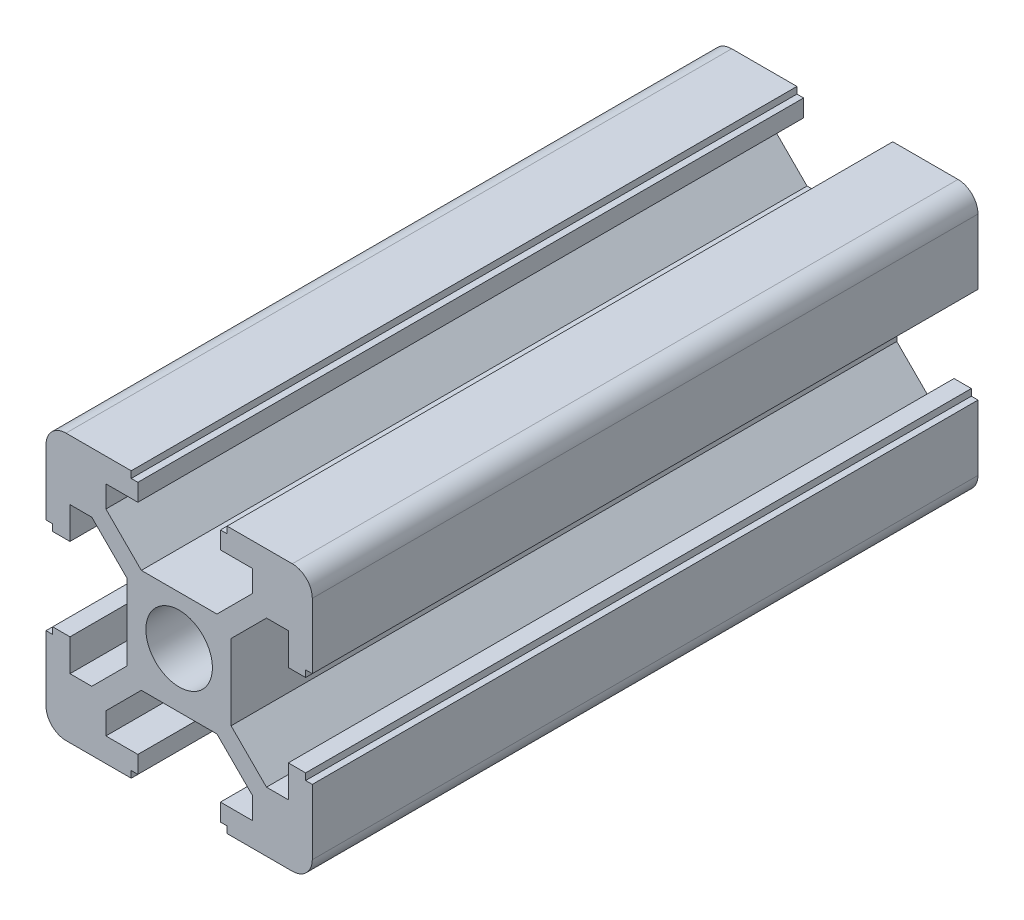
from build123d import *

# Parameters (mm, degrees)
SKETCH1_R           = 2.5
BOSS_EXTRUDE1_DEPTH = 50
SCALE_2_SCALE       = 3
SCALE_3_SCALE       = 6
SCALE_5_SCALE       = 2
SCALE_6_SCALE       = 0.25
SCALE_7_SCALE       = 0.125
SCALE_8_SCALE       = 0.25
SCALE_9_SCALE       = 4
SCALE_10_SCALE      = 4
OTHER_START         = -17.55
OTHER_1_OUTLINE_R   = 5
OTHER_1_DEPTH       = 10
SCALE_11_SCALE      = 0.111111111


# Read off the part's stored shape, not the designer's step: 孔1
with BuildPart() as part:
    # Sketch1 → Boss-Extrude1 (new body)
    with BuildSketch(Plane.XY):
        with BuildLine():
            Line((2.839339828, 3.9), (5.5, 6.560660172))
            Line((5.5, 6.560660172), (5.5, 8.2))
            Line((5.5, 8.2), (3.1, 8.2))
            Line((3.1, 8.2), (3.1, 9.5))
            Line((3.1, 9.5), (3.6, 9.5))
            Line((3.6, 9.5), (3.6, 10))
            Line((3.6, 10), (8.5, 10))
            ThreePointArc((8.5, 10), (9.560660172, 9.560660172), (10, 8.5))
            Line((10, 8.5), (10, 3.6))
            Line((10, 3.6), (9.5, 3.6))
            Line((9.5, 3.6), (9.5, 3.1))
            Line((9.5, 3.1), (8.2, 3.1))
            Line((8.2, 3.1), (8.2, 5.5))
            Line((8.2, 5.5), (6.560660172, 5.5))
            Line((6.560660172, 5.5), (3.9, 2.839339828))
            Line((3.9, 2.839339828), (3.9, -2.839339828))
            Line((3.9, -2.839339828), (6.560660172, -5.5))
            Line((6.560660172, -5.5), (8.2, -5.5))
            Line((8.2, -5.5), (8.2, -3.1))
            Line((8.2, -3.1), (9.5, -3.1))
            Line((9.5, -3.1), (9.5, -3.6))
            Line((9.5, -3.6), (10, -3.6))
            Line((10, -3.6), (10, -8.5))
            ThreePointArc((10, -8.5), (9.560660172, -9.560660172), (8.5, -10))
            Line((8.5, -10), (3.6, -10))
            Line((3.6, -10), (3.6, -9.5))
            Line((3.6, -9.5), (3.1, -9.5))
            Line((3.1, -9.5), (3.1, -8.2))
            Line((3.1, -8.2), (5.5, -8.2))
            Line((5.5, -8.2), (5.5, -6.560660172))
            Line((5.5, -6.560660172), (2.839339828, -3.9))
            Line((2.839339828, -3.9), (-2.839339828, -3.9))
            Line((-2.839339828, -3.9), (-5.5, -6.560660172))
            Line((-5.5, -6.560660172), (-5.5, -8.2))
            Line((-5.5, -8.2), (-3.1, -8.2))
            Line((-3.1, -8.2), (-3.1, -9.5))
            Line((-3.1, -9.5), (-3.6, -9.5))
            Line((-3.6, -9.5), (-3.6, -10))
            Line((-3.6, -10), (-8.5, -10))
            ThreePointArc((-8.5, -10), (-9.560660172, -9.560660172), (-10, -8.5))
            Line((-10, -8.5), (-10, -3.6))
            Line((-10, -3.6), (-9.5, -3.6))
            Line((-9.5, -3.6), (-9.5, -3.1))
            Line((-9.5, -3.1), (-8.2, -3.1))
            Line((-8.2, -3.1), (-8.2, -5.5))
            Line((-8.2, -5.5), (-6.560660172, -5.5))
            Line((-6.560660172, -5.5), (-3.9, -2.839339828))
            Line((-3.9, -2.839339828), (-3.9, 2.839339828))
            Line((-3.9, 2.839339828), (-6.560660172, 5.5))
            Line((-6.560660172, 5.5), (-8.2, 5.5))
            Line((-8.2, 5.5), (-8.2, 3.1))
            Line((-8.2, 3.1), (-9.5, 3.1))
            Line((-9.5, 3.1), (-9.5, 3.6))
            Line((-9.5, 3.6), (-10, 3.6))
            Line((-10, 3.6), (-10, 8.5))
            ThreePointArc((-10, 8.5), (-9.560660172, 9.560660172), (-8.5, 10))
            Line((-8.5, 10), (-3.6, 10))
            Line((-3.6, 10), (-3.6, 9.5))
            Line((-3.6, 9.5), (-3.1, 9.5))
            Line((-3.1, 9.5), (-3.1, 8.2))
            Line((-3.1, 8.2), (-5.5, 8.2))
            Line((-5.5, 8.2), (-5.5, 6.560660172))
            Line((-5.5, 6.560660172), (-2.839339828, 3.9))
            Line((-2.839339828, 3.9), (2.839339828, 3.9))
        make_face()
        with Locations((0, 0.235847297)):
            Circle(SKETCH1_R, mode=Mode.SUBTRACT)
    extrude(amount=BOSS_EXTRUDE1_DEPTH)


with BuildPart() as part_1:
    # 缩放比例2: scaled about (0, -0.027095247, 25)
    add(part.part.scale(SCALE_2_SCALE).moved(Location((0, 0.054190494, -50))))


with BuildPart() as part_2:
    # 缩放比例3: scaled about (0, -0.027095247, 25)
    add(part_1.part.scale(SCALE_3_SCALE).moved(Location((0, 0.135476235, -125))))


with BuildPart() as part_3:
    # 缩放比例5: scaled about (0, -0.027095249, 25)
    add(part_2.part.scale(SCALE_5_SCALE).moved(Location((0, 0.027095249, -25))))


with BuildPart() as part_4:
    # 缩放比例6: scaled about (0, -0.027095249, 25)
    add(part_3.part.scale(SCALE_6_SCALE).moved(Location((0, -0.020321437, 18.75))))


with BuildPart() as part_5:
    # 缩放比例7: scaled about (0, -0.027095249, 25)
    add(part_4.part.scale(SCALE_7_SCALE).moved(Location((0, -0.023708343, 21.875))))


with BuildPart() as part_6:
    # 缩放比例8: scaled about (0, -0.027095249, 25)
    add(part_5.part.scale(SCALE_8_SCALE).moved(Location((0, -0.020321437, 18.75))))


with BuildPart() as part_7:
    # 缩放比例9: scaled about (0, -0.027095249, 25)
    add(part_6.part.scale(SCALE_9_SCALE).moved(Location((0, 0.081285747, -75))))


with BuildPart() as part_8:
    # 缩放比例10: scaled about (0, -0.027095249, 25)
    add(part_7.part.scale(SCALE_10_SCALE).moved(Location((0, 0.081285747, -75))))

    # 孔1 outline → 孔1 (cut)
    with BuildSketch(Plane.YZ.offset(OTHER_START)):
        with Locations((7.344833538, 1.297306883)):
            Circle(OTHER_1_OUTLINE_R)
    extrude(amount=OTHER_1_DEPTH, mode=Mode.SUBTRACT)


with BuildPart() as part_9:
    # 缩放比例11: scaled about (0.011151362, -0.033595737, 25.019879338)
    add(part_8.part.scale(SCALE_11_SCALE).moved(Location((0.009912322, -0.029862877, 22.239892745))))


solid = part_9.part
